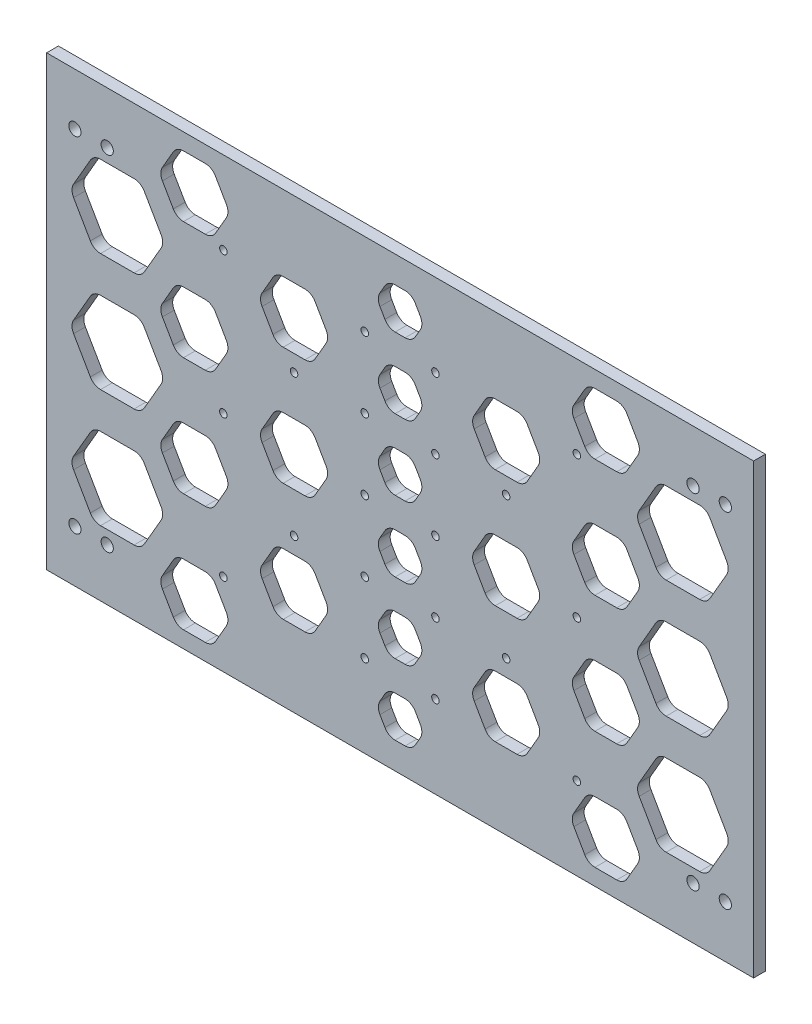
from build123d import *

# Parameters (mm, degrees)
EXTRUDE_2_DEPTH     = 5
SKETCH_2_W          = 5
SKETCH_2_H          = 30
CUT_EXTRUDE_1_DEPTH = 10
CUT_EXTRUDE_2_DEPTH = 10
EXTRUDE_3_REACH     = 316.046
SKETCH_4_W          = 5
SKETCH_4_H          = 50
SKETCH_5_R          = 1
SKETCH_5_W          = 5
SKETCH_5_H          = 30
CUT_EXTRUDE_3_DEPTH = 5
SKETCH_6_R          = 2.6
CUT_EXTRUDE_4_DEPTH = 356.140817142
SKETCH_7_R          = 1.6
CUT_EXTRUDE_5_DEPTH = 356.140817142
CUT_EXTRUDE_6_DEPTH = 10
CUT_EXTRUDE_7_DEPTH = 10
CUT_EXTRUDE_8_DEPTH = 10
EXTRUDE_4_DEPTH     = 5
CUT_EXTRUDE_9_DEPTH = 10
EXTRUDE_5_DEPTH     = 5
FILLET_2_R          = 5
FILLET_3_R          = 5


with BuildPart() as part:
    # 草图1 → 凸台-拉伸2 (new body)
    with BuildSketch(Plane.XY):
        Polygon((0, 0), (0, -95), (300, -95), (300, 0), (250, 0), (250, -50), (50, -50), (50, 0), align=None)
        Polygon((300, -95), (0, -95), (0, -190), (50, -190), (50, -140), (250, -140), (250, -190), (300, -190), align=None)
    extrude(amount=EXTRUDE_2_DEPTH)

    # 草图2 → 切除-拉伸1 (cut)
    with BuildSketch(Plane.XY.offset(5)):
        with Locations((2.5, -50)):
            Rectangle(SKETCH_2_W, SKETCH_2_H)
        with Locations((2.5, -140)):
            Rectangle(SKETCH_2_W, SKETCH_2_H)
        with Locations((297.5, -50)):
            Rectangle(SKETCH_2_W, SKETCH_2_H)
        with Locations((297.5, -140)):
            Rectangle(SKETCH_2_W, SKETCH_2_H)
    extrude(amount=-CUT_EXTRUDE_1_DEPTH, mode=Mode.SUBTRACT)

    # 草图3 → 切除-拉伸2 (cut)
    with BuildSketch(Plane.XY.offset(5)):
        with BuildLine():
            ThreePointArc((4, -35), (4.292893219, -35.707106781), (5, -36))
            Line((5, -36), (5, -35))
            Line((5, -35), (4, -35))
        make_face()
        with BuildLine():
            Line((5, -35), (5, -36))
            ThreePointArc((5, -36), (5.707106781, -35.707106781), (6, -35))
            ThreePointArc((6, -35), (5, -34), (4, -35))
            Line((4, -35), (5, -35))
        make_face()
        with BuildLine():
            ThreePointArc((4, -35), (4.292893219, -35.707106781), (5, -36))
            Line((5, -36), (5, -35))
            Line((5, -35), (4, -35))
        make_face()
        with BuildLine():
            Line((5, -35), (5, -36))
            ThreePointArc((5, -36), (5.707106781, -35.707106781), (6, -35))
            ThreePointArc((6, -35), (5, -34), (4, -35))
            Line((4, -35), (5, -35))
        make_face()
        with BuildLine():
            ThreePointArc((5, -64), (4.292893219, -64.292893219), (4, -65))
            Line((4, -65), (5, -65))
            Line((5, -65), (5, -64))
        make_face()
        with BuildLine():
            Line((5, -65), (4, -65))
            ThreePointArc((4, -65), (5, -66), (6, -65))
            ThreePointArc((6, -65), (5.707106781, -64.292893219), (5, -64))
            Line((5, -64), (5, -65))
        make_face()
        with BuildLine():
            ThreePointArc((6, -125), (5, -124), (4, -125))
            Line((4, -125), (5, -125))
            Line((5, -125), (5, -126))
            ThreePointArc((5, -126), (5.707106781, -125.707106781), (6, -125))
        make_face()
        with BuildLine():
            Line((5, -125), (4, -125))
            ThreePointArc((4, -125), (4.292893219, -125.707106781), (5, -126))
            Line((5, -126), (5, -125))
        make_face()
        with BuildLine():
            ThreePointArc((6, -155), (5.707106781, -154.292893219), (5, -154))
            Line((5, -154), (5, -155))
            Line((5, -155), (4, -155))
            ThreePointArc((4, -155), (5, -156), (6, -155))
        make_face()
        with BuildLine():
            Line((5, -155), (5, -154))
            ThreePointArc((5, -154), (4.292893219, -154.292893219), (4, -155))
            Line((4, -155), (5, -155))
        make_face()
        with BuildLine():
            ThreePointArc((296, -155), (295.707106781, -154.292893219), (295, -154))
            Line((295, -154), (295, -155))
            Line((295, -155), (296, -155))
        make_face()
        with BuildLine():
            Line((295, -155), (295, -154))
            ThreePointArc((295, -154), (294.292893219, -155.707106781), (296, -155))
            Line((296, -155), (295, -155))
        make_face()
        with BuildLine():
            ThreePointArc((295, -126), (295.707106781, -125.707106781), (296, -125))
            Line((296, -125), (295, -125))
            Line((295, -125), (295, -126))
        make_face()
        with BuildLine():
            Line((295, -125), (296, -125))
            ThreePointArc((296, -125), (294.292893219, -124.292893219), (295, -126))
            Line((295, -126), (295, -125))
        make_face()
        with BuildLine():
            ThreePointArc((296, -35), (294.292893219, -34.292893219), (295, -36))
            Line((295, -36), (295, -35))
            Line((295, -35), (296, -35))
        make_face()
        with BuildLine():
            Line((295, -35), (295, -36))
            ThreePointArc((295, -36), (295.707106781, -35.707106781), (296, -35))
            Line((296, -35), (295, -35))
        make_face()
        with BuildLine():
            ThreePointArc((295, -64), (294.292893219, -65.707106781), (296, -65))
            Line((296, -65), (295, -65))
            Line((295, -65), (295, -64))
        make_face()
        with BuildLine():
            Line((295, -65), (296, -65))
            ThreePointArc((296, -65), (295.707106781, -64.292893219), (295, -64))
            Line((295, -64), (295, -65))
        make_face()
    extrude(amount=-CUT_EXTRUDE_2_DEPTH, mode=Mode.SUBTRACT)

    # 草图4 → 凸台-拉伸3 (add, up to next)
    with BuildSketch(Plane(origin=(50, 0, 0), x_dir=(0, 0, -1), z_dir=(1, 0, 0)), mode=Mode.PRIVATE) as extrude_3_sk1:
        with Locations((-2.5, -25)):
            Rectangle(SKETCH_4_W, SKETCH_4_H)
    extrude_3_tool1 = extrude(extrude_3_sk1.sketch, amount=EXTRUDE_3_REACH, mode=Mode.PRIVATE) - part.part
    # 草图4 → 凸台-拉伸3 (add, up to next)
    with BuildSketch(Plane(origin=(50, 0, 0), x_dir=(0, 0, -1), z_dir=(1, 0, 0)), mode=Mode.PRIVATE) as extrude_3_sk2:
        with Locations((-2.5, -165)):
            Rectangle(SKETCH_4_W, SKETCH_4_H)
    extrude_3_tool2 = extrude(extrude_3_sk2.sketch, amount=EXTRUDE_3_REACH, mode=Mode.PRIVATE) - part.part
    add(extrude_3_tool1.solids().sort_by_distance((50, -25, 2.5))[0])
    add(extrude_3_tool2.solids().sort_by_distance((50, -165, 2.5))[0])

    # 草图5 → 切除-拉伸3 (cut)
    with BuildSketch(Plane.XY.offset(5)):
        with Locations((37.7, -65)):
            Circle(SKETCH_5_R)
        with Locations((37.7, -35)):
            Circle(SKETCH_5_R)
        with Locations((32.7, -35)):
            Circle(SKETCH_5_R)
        with Locations((32.7, -65)):
            Circle(SKETCH_5_R)
        with Locations((35.2, -50)):
            Rectangle(SKETCH_5_W, SKETCH_5_H)
        with BuildLine():
            Line((32.7, -36), (32.7, -35))
            Line((32.7, -35), (33.7, -35))
            ThreePointArc((33.7, -35), (31.992893219, -34.292893219), (32.7, -36))
        make_face()
        with BuildLine():
            Line((33.7, -35), (32.7, -35))
            Line((32.7, -35), (32.7, -36))
            ThreePointArc((32.7, -36), (33.407106781, -35.707106781), (33.7, -35))
        make_face()
        with BuildLine():
            ThreePointArc((38.7, -35), (37.7, -34), (36.7, -35))
            Line((36.7, -35), (37.7, -35))
            Line((37.7, -35), (37.7, -36))
            ThreePointArc((37.7, -36), (38.407106781, -35.707106781), (38.7, -35))
        make_face()
        with BuildLine():
            Line((37.7, -35), (36.7, -35))
            ThreePointArc((36.7, -35), (36.992893219, -35.707106781), (37.7, -36))
            Line((37.7, -36), (37.7, -35))
        make_face()
        with BuildLine():
            ThreePointArc((38.7, -35), (37.7, -34), (36.7, -35))
            Line((36.7, -35), (37.7, -35))
            Line((37.7, -35), (37.7, -36))
            ThreePointArc((37.7, -36), (38.407106781, -35.707106781), (38.7, -35))
        make_face()
        with BuildLine():
            Line((37.7, -35), (36.7, -35))
            ThreePointArc((36.7, -35), (36.992893219, -35.707106781), (37.7, -36))
            Line((37.7, -36), (37.7, -35))
        make_face()
        with BuildLine():
            Line((32.7, -36), (32.7, -35))
            Line((32.7, -35), (33.7, -35))
            ThreePointArc((33.7, -35), (31.992893219, -34.292893219), (32.7, -36))
        make_face()
        with BuildLine():
            Line((33.7, -35), (32.7, -35))
            Line((32.7, -35), (32.7, -36))
            ThreePointArc((32.7, -36), (33.407106781, -35.707106781), (33.7, -35))
        make_face()
        with BuildLine():
            ThreePointArc((33.7, -65), (33.407106781, -64.292893219), (32.7, -64))
            Line((32.7, -64), (32.7, -65))
            Line((32.7, -65), (33.7, -65))
        make_face()
        with BuildLine():
            Line((32.7, -65), (32.7, -64))
            ThreePointArc((32.7, -64), (31.992893219, -65.707106781), (33.7, -65))
            Line((33.7, -65), (32.7, -65))
        make_face()
        with BuildLine():
            ThreePointArc((33.7, -65), (33.407106781, -64.292893219), (32.7, -64))
            Line((32.7, -64), (32.7, -65))
            Line((32.7, -65), (33.7, -65))
        make_face()
        with BuildLine():
            Line((32.7, -65), (32.7, -64))
            ThreePointArc((32.7, -64), (31.992893219, -65.707106781), (33.7, -65))
            Line((33.7, -65), (32.7, -65))
        make_face()
        with BuildLine():
            ThreePointArc((38.7, -65), (38.407106781, -64.292893219), (37.7, -64))
            Line((37.7, -64), (37.7, -65))
            Line((37.7, -65), (36.7, -65))
            ThreePointArc((36.7, -65), (37.7, -66), (38.7, -65))
        make_face()
        with BuildLine():
            Line((37.7, -65), (37.7, -64))
            ThreePointArc((37.7, -64), (36.992893219, -64.292893219), (36.7, -65))
            Line((36.7, -65), (37.7, -65))
        make_face()
        with BuildLine():
            ThreePointArc((38.7, -65), (38.407106781, -64.292893219), (37.7, -64))
            Line((37.7, -64), (37.7, -65))
            Line((37.7, -65), (36.7, -65))
            ThreePointArc((36.7, -65), (37.7, -66), (38.7, -65))
        make_face()
        with BuildLine():
            Line((37.7, -65), (37.7, -64))
            ThreePointArc((37.7, -64), (36.992893219, -64.292893219), (36.7, -65))
            Line((36.7, -65), (37.7, -65))
        make_face()
        with BuildLine():
            ThreePointArc((33.7, -155), (33.407106781, -154.292893219), (32.7, -154))
            Line((32.7, -154), (32.7, -155))
            Line((32.7, -155), (33.7, -155))
        make_face()
        with BuildLine():
            Line((32.7, -155), (32.7, -154))
            ThreePointArc((32.7, -154), (31.992893219, -155.707106781), (33.7, -155))
            Line((33.7, -155), (32.7, -155))
        make_face()
        with BuildLine():
            ThreePointArc((33.7, -155), (33.407106781, -154.292893219), (32.7, -154))
            Line((32.7, -154), (32.7, -155))
            Line((32.7, -155), (33.7, -155))
        make_face()
        with BuildLine():
            Line((32.7, -155), (32.7, -154))
            ThreePointArc((32.7, -154), (31.992893219, -155.707106781), (33.7, -155))
            Line((33.7, -155), (32.7, -155))
        make_face()
        with Locations((32.7, -155)):
            Circle(SKETCH_5_R)
        with Locations((37.7, -155)):
            Circle(SKETCH_5_R)
        with Locations((37.7, -125)):
            Circle(SKETCH_5_R)
        with Locations((32.7, -125)):
            Circle(SKETCH_5_R)
        with Locations((35.2, -140)):
            Rectangle(SKETCH_5_W, SKETCH_5_H)
        with BuildLine():
            ThreePointArc((38.7, -155), (38.407106781, -154.292893219), (37.7, -154))
            Line((37.7, -154), (37.7, -155))
            Line((37.7, -155), (36.7, -155))
            ThreePointArc((36.7, -155), (37.7, -156), (38.7, -155))
        make_face()
        with BuildLine():
            Line((37.7, -155), (37.7, -154))
            ThreePointArc((37.7, -154), (36.992893219, -154.292893219), (36.7, -155))
            Line((36.7, -155), (37.7, -155))
        make_face()
        with BuildLine():
            ThreePointArc((38.7, -155), (38.407106781, -154.292893219), (37.7, -154))
            Line((37.7, -154), (37.7, -155))
            Line((37.7, -155), (36.7, -155))
            ThreePointArc((36.7, -155), (37.7, -156), (38.7, -155))
        make_face()
        with BuildLine():
            Line((37.7, -155), (37.7, -154))
            ThreePointArc((37.7, -154), (36.992893219, -154.292893219), (36.7, -155))
            Line((36.7, -155), (37.7, -155))
        make_face()
        with BuildLine():
            Line((32.7, -126), (32.7, -125))
            Line((32.7, -125), (33.7, -125))
            ThreePointArc((33.7, -125), (31.992893219, -124.292893219), (32.7, -126))
        make_face()
        with BuildLine():
            Line((33.7, -125), (32.7, -125))
            Line((32.7, -125), (32.7, -126))
            ThreePointArc((32.7, -126), (33.407106781, -125.707106781), (33.7, -125))
        make_face()
        with BuildLine():
            Line((32.7, -126), (32.7, -125))
            Line((32.7, -125), (33.7, -125))
            ThreePointArc((33.7, -125), (31.992893219, -124.292893219), (32.7, -126))
        make_face()
        with BuildLine():
            Line((33.7, -125), (32.7, -125))
            Line((32.7, -125), (32.7, -126))
            ThreePointArc((32.7, -126), (33.407106781, -125.707106781), (33.7, -125))
        make_face()
        with BuildLine():
            ThreePointArc((38.7, -125), (37.7, -124), (36.7, -125))
            Line((36.7, -125), (37.7, -125))
            Line((37.7, -125), (37.7, -126))
            ThreePointArc((37.7, -126), (38.407106781, -125.707106781), (38.7, -125))
        make_face()
        with BuildLine():
            Line((37.7, -125), (36.7, -125))
            ThreePointArc((36.7, -125), (36.992893219, -125.707106781), (37.7, -126))
            Line((37.7, -126), (37.7, -125))
        make_face()
        with BuildLine():
            ThreePointArc((38.7, -125), (37.7, -124), (36.7, -125))
            Line((36.7, -125), (37.7, -125))
            Line((37.7, -125), (37.7, -126))
            ThreePointArc((37.7, -126), (38.407106781, -125.707106781), (38.7, -125))
        make_face()
        with BuildLine():
            Line((37.7, -125), (36.7, -125))
            ThreePointArc((36.7, -125), (36.992893219, -125.707106781), (37.7, -126))
            Line((37.7, -126), (37.7, -125))
        make_face()
        with Locations((262.3, -65)):
            Circle(SKETCH_5_R)
        with Locations((267.3, -65)):
            Circle(SKETCH_5_R)
        with Locations((267.3, -35)):
            Circle(SKETCH_5_R)
        with Locations((262.3, -35)):
            Circle(SKETCH_5_R)
        with Locations((264.8, -50)):
            Rectangle(SKETCH_5_W, SKETCH_5_H)
        with BuildLine():
            ThreePointArc((263.3, -35), (261.592893219, -34.292893219), (262.3, -36))
            Line((262.3, -36), (262.3, -35))
            Line((262.3, -35), (263.3, -35))
        make_face()
        with BuildLine():
            Line((262.3, -35), (262.3, -36))
            ThreePointArc((262.3, -36), (263.007106781, -35.707106781), (263.3, -35))
            Line((263.3, -35), (262.3, -35))
        make_face()
        with BuildLine():
            ThreePointArc((263.3, -35), (261.592893219, -34.292893219), (262.3, -36))
            Line((262.3, -36), (262.3, -35))
            Line((262.3, -35), (263.3, -35))
        make_face()
        with BuildLine():
            Line((262.3, -35), (262.3, -36))
            ThreePointArc((262.3, -36), (263.007106781, -35.707106781), (263.3, -35))
            Line((263.3, -35), (262.3, -35))
        make_face()
        with BuildLine():
            ThreePointArc((266.3, -35), (266.592893219, -35.707106781), (267.3, -36))
            Line((267.3, -36), (267.3, -35))
            Line((267.3, -35), (266.3, -35))
        make_face()
        with BuildLine():
            Line((267.3, -35), (267.3, -36))
            ThreePointArc((267.3, -36), (268.007106781, -35.707106781), (268.3, -35))
            ThreePointArc((268.3, -35), (267.3, -34), (266.3, -35))
            Line((266.3, -35), (267.3, -35))
        make_face()
        with BuildLine():
            ThreePointArc((266.3, -35), (266.592893219, -35.707106781), (267.3, -36))
            Line((267.3, -36), (267.3, -35))
            Line((267.3, -35), (266.3, -35))
        make_face()
        with BuildLine():
            Line((267.3, -35), (267.3, -36))
            ThreePointArc((267.3, -36), (268.007106781, -35.707106781), (268.3, -35))
            ThreePointArc((268.3, -35), (267.3, -34), (266.3, -35))
            Line((266.3, -35), (267.3, -35))
        make_face()
        with BuildLine():
            ThreePointArc((262.3, -64), (261.592893219, -65.707106781), (263.3, -65))
            Line((263.3, -65), (262.3, -65))
            Line((262.3, -65), (262.3, -64))
        make_face()
        with BuildLine():
            Line((262.3, -65), (263.3, -65))
            ThreePointArc((263.3, -65), (263.007106781, -64.292893219), (262.3, -64))
            Line((262.3, -64), (262.3, -65))
        make_face()
        with BuildLine():
            ThreePointArc((262.3, -64), (261.592893219, -65.707106781), (263.3, -65))
            Line((263.3, -65), (262.3, -65))
            Line((262.3, -65), (262.3, -64))
        make_face()
        with BuildLine():
            Line((262.3, -65), (263.3, -65))
            ThreePointArc((263.3, -65), (263.007106781, -64.292893219), (262.3, -64))
            Line((262.3, -64), (262.3, -65))
        make_face()
        with BuildLine():
            ThreePointArc((267.3, -64), (266.592893219, -64.292893219), (266.3, -65))
            Line((266.3, -65), (267.3, -65))
            Line((267.3, -65), (267.3, -64))
        make_face()
        with BuildLine():
            Line((267.3, -65), (266.3, -65))
            ThreePointArc((266.3, -65), (267.3, -66), (268.3, -65))
            ThreePointArc((268.3, -65), (268.007106781, -64.292893219), (267.3, -64))
            Line((267.3, -64), (267.3, -65))
        make_face()
        with BuildLine():
            ThreePointArc((267.3, -64), (266.592893219, -64.292893219), (266.3, -65))
            Line((266.3, -65), (267.3, -65))
            Line((267.3, -65), (267.3, -64))
        make_face()
        with BuildLine():
            Line((267.3, -65), (266.3, -65))
            ThreePointArc((266.3, -65), (267.3, -66), (268.3, -65))
            ThreePointArc((268.3, -65), (268.007106781, -64.292893219), (267.3, -64))
            Line((267.3, -64), (267.3, -65))
        make_face()
        with BuildLine():
            ThreePointArc((262.3, -126), (263.007106781, -125.707106781), (263.3, -125))
            Line((263.3, -125), (262.3, -125))
            Line((262.3, -125), (262.3, -126))
        make_face()
        with BuildLine():
            Line((262.3, -125), (263.3, -125))
            ThreePointArc((263.3, -125), (261.592893219, -124.292893219), (262.3, -126))
            Line((262.3, -126), (262.3, -125))
        make_face()
        with BuildLine():
            ThreePointArc((262.3, -126), (263.007106781, -125.707106781), (263.3, -125))
            Line((263.3, -125), (262.3, -125))
            Line((262.3, -125), (262.3, -126))
        make_face()
        with BuildLine():
            Line((262.3, -125), (263.3, -125))
            ThreePointArc((263.3, -125), (261.592893219, -124.292893219), (262.3, -126))
            Line((262.3, -126), (262.3, -125))
        make_face()
        with Locations((267.3, -125)):
            Circle(SKETCH_5_R)
        with Locations((262.3, -125)):
            Circle(SKETCH_5_R)
        with Locations((262.3, -155)):
            Circle(SKETCH_5_R)
        with Locations((267.3, -155)):
            Circle(SKETCH_5_R)
        with Locations((264.8, -140)):
            Rectangle(SKETCH_5_W, SKETCH_5_H)
        with BuildLine():
            ThreePointArc((266.3, -125), (266.592893219, -125.707106781), (267.3, -126))
            Line((267.3, -126), (267.3, -125))
            Line((267.3, -125), (266.3, -125))
        make_face()
        with BuildLine():
            Line((267.3, -125), (267.3, -126))
            ThreePointArc((267.3, -126), (268.007106781, -125.707106781), (268.3, -125))
            ThreePointArc((268.3, -125), (267.3, -124), (266.3, -125))
            Line((266.3, -125), (267.3, -125))
        make_face()
        with BuildLine():
            ThreePointArc((266.3, -125), (266.592893219, -125.707106781), (267.3, -126))
            Line((267.3, -126), (267.3, -125))
            Line((267.3, -125), (266.3, -125))
        make_face()
        with BuildLine():
            Line((267.3, -125), (267.3, -126))
            ThreePointArc((267.3, -126), (268.007106781, -125.707106781), (268.3, -125))
            ThreePointArc((268.3, -125), (267.3, -124), (266.3, -125))
            Line((266.3, -125), (267.3, -125))
        make_face()
        with BuildLine():
            ThreePointArc((262.3, -154), (261.592893219, -155.707106781), (263.3, -155))
            Line((263.3, -155), (262.3, -155))
            Line((262.3, -155), (262.3, -154))
        make_face()
        with BuildLine():
            Line((262.3, -155), (263.3, -155))
            ThreePointArc((263.3, -155), (263.007106781, -154.292893219), (262.3, -154))
            Line((262.3, -154), (262.3, -155))
        make_face()
        with BuildLine():
            ThreePointArc((262.3, -154), (261.592893219, -155.707106781), (263.3, -155))
            Line((263.3, -155), (262.3, -155))
            Line((262.3, -155), (262.3, -154))
        make_face()
        with BuildLine():
            Line((262.3, -155), (263.3, -155))
            ThreePointArc((263.3, -155), (263.007106781, -154.292893219), (262.3, -154))
            Line((262.3, -154), (262.3, -155))
        make_face()
        with BuildLine():
            Line((266.3, -155), (267.3, -155))
            Line((267.3, -155), (267.3, -154))
            ThreePointArc((267.3, -154), (266.592893219, -154.292893219), (266.3, -155))
        make_face()
        with BuildLine():
            Line((267.3, -154), (267.3, -155))
            Line((267.3, -155), (266.3, -155))
            ThreePointArc((266.3, -155), (267.3, -156), (268.3, -155))
            ThreePointArc((268.3, -155), (268.007106781, -154.292893219), (267.3, -154))
        make_face()
        with BuildLine():
            Line((266.3, -155), (267.3, -155))
            Line((267.3, -155), (267.3, -154))
            ThreePointArc((267.3, -154), (266.592893219, -154.292893219), (266.3, -155))
        make_face()
        with BuildLine():
            Line((267.3, -154), (267.3, -155))
            Line((267.3, -155), (266.3, -155))
            ThreePointArc((266.3, -155), (267.3, -156), (268.3, -155))
            ThreePointArc((268.3, -155), (268.007106781, -154.292893219), (267.3, -154))
        make_face()
    extrude(amount=-CUT_EXTRUDE_3_DEPTH, mode=Mode.SUBTRACT)

    # 草图6 → 切除-拉伸4 (cut, through all)
    with BuildSketch(Plane.XY.offset(5)):
        with Locations((12, -22)):
            Circle(SKETCH_6_R)
        with Locations((25.7, -22)):
            Circle(SKETCH_6_R)
        with Locations((12, -168)):
            Circle(SKETCH_6_R)
        with Locations((25.7, -168)):
            Circle(SKETCH_6_R)
        with Locations((274.3, -168)):
            Circle(SKETCH_6_R)
        with Locations((288, -168)):
            Circle(SKETCH_6_R)
        with Locations((274.3, -22)):
            Circle(SKETCH_6_R)
        with Locations((288, -22)):
            Circle(SKETCH_6_R)
    extrude(amount=-CUT_EXTRUDE_4_DEPTH, mode=Mode.SUBTRACT)

    # 草图7 → 切除-拉伸5 (cut, through all)
    with BuildSketch(Plane.XY.offset(5)):
        with Locations((75, -35)):
            Circle(SKETCH_7_R)
        with Locations((105, -35)):
            Circle(SKETCH_7_R)
        with Locations((135, -35)):
            Circle(SKETCH_7_R)
        with Locations((165, -35)):
            Circle(SKETCH_7_R)
        with Locations((195, -35)):
            Circle(SKETCH_7_R)
        with Locations((225, -35)):
            Circle(SKETCH_7_R)
        with Locations((105, -65)):
            Circle(SKETCH_7_R)
        with Locations((135, -65)):
            Circle(SKETCH_7_R)
        with Locations((165, -65)):
            Circle(SKETCH_7_R)
        with Locations((195, -65)):
            Circle(SKETCH_7_R)
        with Locations((225, -65)):
            Circle(SKETCH_7_R)
        with Locations((105, -95)):
            Circle(SKETCH_7_R)
        with Locations((135, -95)):
            Circle(SKETCH_7_R)
        with Locations((165, -95)):
            Circle(SKETCH_7_R)
        with Locations((195, -95)):
            Circle(SKETCH_7_R)
        with Locations((225, -95)):
            Circle(SKETCH_7_R)
        with Locations((105, -125)):
            Circle(SKETCH_7_R)
        with Locations((135, -125)):
            Circle(SKETCH_7_R)
        with Locations((165, -125)):
            Circle(SKETCH_7_R)
        with Locations((195, -125)):
            Circle(SKETCH_7_R)
        with Locations((225, -125)):
            Circle(SKETCH_7_R)
        with Locations((105, -155)):
            Circle(SKETCH_7_R)
        with Locations((135, -155)):
            Circle(SKETCH_7_R)
        with Locations((165, -155)):
            Circle(SKETCH_7_R)
        with Locations((195, -155)):
            Circle(SKETCH_7_R)
        with Locations((225, -155)):
            Circle(SKETCH_7_R)
        with Locations((75, -65)):
            Circle(SKETCH_7_R)
        with Locations((75, -95)):
            Circle(SKETCH_7_R)
        with Locations((75, -125)):
            Circle(SKETCH_7_R)
        with Locations((75, -155)):
            Circle(SKETCH_7_R)
    extrude(amount=-CUT_EXTRUDE_5_DEPTH, mode=Mode.SUBTRACT)

    # 草图9 → 切除-拉伸6 (cut)
    with BuildSketch(Plane.XY.offset(5)):
        Polygon((55.2, -32.990762114), (70.2, -32.990762114), (77.7, -20.000381057), (70.2, -7.01), (55.2, -7.01), (47.7, -20.000381057), align=None)
        Polygon((97.5, -57.990381057), (112.5, -57.990381057), (120, -45), (112.5, -32.009618943), (97.5, -32.009618943), (90, -45), align=None)
        Polygon((55.2, -82.990762114), (70.2, -82.990762114), (77.7, -70.000381057), (70.2, -57.01), (55.2, -57.01), (47.7, -70.000381057), align=None)
        Polygon((90, -95), (120, -95), (112.5, -82.009618943), (97.5, -82.009618943), align=None)
        Polygon((55.2, -132.990762114), (70.2, -132.990762114), (77.7, -120.000381057), (70.2, -107.01), (55.2, -107.01), (47.7, -120.000381057), align=None)
        Polygon((112.5, -107.990381057), (120, -95), (90, -95), (97.5, -107.990381057), align=None)
        Polygon((120, -145), (112.5, -157.990381057), (97.5, -157.990381057), (90, -145), (97.5, -132.009618943), (112.5, -132.009618943), align=None)
        Polygon((55.2, -182.990762114), (70.2, -182.990762114), (77.7, -170.000381057), (70.2, -157.01), (55.2, -157.01), (47.7, -170.000381057), align=None)
        Polygon((180, -145), (187.5, -157.990381057), (202.5, -157.990381057), (210, -145), (202.5, -132.009618943), (187.5, -132.009618943), align=None)
        Polygon((222.3, -170.000381057), (229.8, -157.01), (244.8, -157.01), (252.3, -170.000381057), (244.8, -182.990762114), (229.8, -182.990762114), align=None)
        Polygon((222.3, -120.000381057), (229.8, -107.01), (244.8, -107.01), (252.3, -120.000381057), (244.8, -132.990762114), (229.8, -132.990762114), align=None)
        Polygon((187.5, -82.009618943), (180, -95), (210, -95), (202.5, -82.009618943), align=None)
        Polygon((222.3, -70.000381057), (229.8, -57.01), (244.8, -57.01), (252.3, -70.000381057), (244.8, -82.990762114), (229.8, -82.990762114), align=None)
        Polygon((210, -95), (180, -95), (187.5, -107.990381057), (202.5, -107.990381057), align=None)
        Polygon((180, -45), (187.5, -32.009618943), (202.5, -32.009618943), (210, -45), (202.5, -57.990381057), (187.5, -57.990381057), align=None)
        Polygon((222.3, -20.000381057), (229.8, -7.01), (244.8, -7.01), (252.3, -20.000381057), (244.8, -32.990762114), (229.8, -32.990762114), align=None)
    extrude(amount=-CUT_EXTRUDE_6_DEPTH, mode=Mode.SUBTRACT)

    # 草图10 → 切除-拉伸7 (cut)
    with BuildSketch(Plane(origin=(0, 0, 0), x_dir=(-1, 0, 0), z_dir=(0, 0, -1))):
        Polygon((-145, -101.339745962), (-150, -101.339745962), (-150, -118.660254038), (-145, -118.660254038), (-140, -110), align=None)
        Polygon((-150, -118.660254038), (-150, -101.339745962), (-155, -101.339745962), (-160, -110), (-155, -118.660254038), align=None)
        Polygon((-145, -11.339745962), (-150, -11.339745962), (-150, -28.660254038), (-145, -28.660254038), (-140, -20), align=None)
        Polygon((-150, -28.660254038), (-150, -11.339745962), (-155, -11.339745962), (-160, -20), (-155, -28.660254038), align=None)
        Polygon((-155, -58.660254038), (-150, -50), (-156.339745962, -43.660254038), (-160, -50), align=None)
        Polygon((-145, -41.339745962), (-150, -50), (-143.660254038, -56.339745962), (-140, -50), align=None)
        Polygon((-145, -41.339745962), (-150, -41.339745962), (-150, -50), align=None)
        Polygon((-150, -50), (-150, -41.339745962), (-155, -41.339745962), (-156.339745962, -43.660254038), align=None)
        Polygon((-150, -58.660254038), (-150, -50), (-155, -58.660254038), align=None)
        Polygon((-143.660254038, -56.339745962), (-150, -50), (-150, -58.660254038), (-145, -58.660254038), align=None)
        Polygon((-150, -88.660254038), (-150, -71.339745962), (-155, -71.339745962), (-160, -80), (-155, -88.660254038), align=None)
        Polygon((-145, -71.339745962), (-150, -71.339745962), (-150, -88.660254038), (-145, -88.660254038), (-140, -80), align=None)
        Polygon((-145, -131.339745962), (-150, -131.339745962), (-150, -148.660254038), (-145, -148.660254038), (-140, -140), align=None)
        Polygon((-150, -148.660254038), (-150, -131.339745962), (-155, -131.339745962), (-160, -140), (-155, -148.660254038), align=None)
        Polygon((-145, -161.339745962), (-150, -161.339745962), (-150, -178.660254038), (-145, -178.660254038), (-140, -170), align=None)
        Polygon((-150, -178.660254038), (-150, -161.339745962), (-155, -161.339745962), (-160, -170), (-155, -178.660254038), align=None)
    extrude(amount=-CUT_EXTRUDE_7_DEPTH, mode=Mode.SUBTRACT)

    # 草图11 → 切除-拉伸8 (cut)
    with BuildSketch(Plane(origin=(0, 0, 0), x_dir=(-1, 0, 0), z_dir=(0, 0, -1))):
        Polygon((-40, -77.679491924), (-50, -95), (-10, -95), (-20, -77.679491924), align=None)
        Polygon((-10, -95), (-50, -95), (-40, -112.320508076), (-20, -112.320508076), align=None)
        Polygon((-280, -77.679491924), (-290, -95), (-250, -95), (-260, -77.679491924), align=None)
        Polygon((-250, -95), (-290, -95), (-280, -112.320508076), (-260, -112.320508076), align=None)
    extrude(amount=-CUT_EXTRUDE_8_DEPTH, mode=Mode.SUBTRACT)

    # 草图12 → 凸台-拉伸4 (add, through all)
    with BuildSketch(Plane.XY.offset(5)):
        with BuildLine():
            Line((33.7, -65), (36.7, -65))
            ThreePointArc((36.7, -65), (38.407106781, -65.707106781), (37.7, -64))
            Line((37.7, -64), (37.7, -36))
            ThreePointArc((37.7, -36), (38.407106781, -34.292893219), (36.7, -35))
            Line((36.7, -35), (33.7, -35))
            ThreePointArc((33.7, -35), (31.992893219, -34.292893219), (32.7, -36))
            Line((32.7, -36), (32.7, -64))
            ThreePointArc((32.7, -64), (31.992893219, -65.707106781), (33.7, -65))
        make_face()
        with BuildLine():
            Line((32.7, -126), (32.7, -154))
            ThreePointArc((32.7, -154), (31.992893219, -155.707106781), (33.7, -155))
            Line((33.7, -155), (36.7, -155))
            ThreePointArc((36.7, -155), (38.407106781, -155.707106781), (37.7, -154))
            Line((37.7, -154), (37.7, -126))
            ThreePointArc((37.7, -126), (38.407106781, -124.292893219), (36.7, -125))
            Line((36.7, -125), (33.7, -125))
            ThreePointArc((33.7, -125), (31.992893219, -124.292893219), (32.7, -126))
        make_face()
        with BuildLine():
            Line((75.656013634, -123.540669293), (74.064189352, -126.297789826))
            ThreePointArc((74.064189352, -126.297789826), (76.385640646, -125.8), (75.656013634, -123.540669293))
        make_face()
        with BuildLine():
            Line((74.063878705, -63.702434232), (75.655664271, -66.459487706))
            ThreePointArc((75.655664271, -66.459487706), (76.385640646, -64.2), (74.063878705, -63.702434232))
        make_face()
        with BuildLine():
            Line((225.936121295, -63.702434232), (224.344335729, -66.459487706))
            ThreePointArc((224.344335729, -66.459487706), (223.614359354, -64.2), (225.936121295, -63.702434232))
        make_face()
        with BuildLine():
            Line((267.3, -64), (267.3, -36))
            ThreePointArc((267.3, -36), (268.007106781, -34.292893219), (266.3, -35))
            Line((266.3, -35), (263.3, -35))
            ThreePointArc((263.3, -35), (261.592893219, -34.292893219), (262.3, -36))
            Line((262.3, -36), (262.3, -64))
            ThreePointArc((262.3, -64), (261.592893219, -65.707106781), (263.3, -65))
            Line((263.3, -65), (266.3, -65))
            ThreePointArc((266.3, -65), (268.007106781, -65.707106781), (267.3, -64))
        make_face()
        with BuildLine():
            Line((266.3, -125), (263.3, -125))
            ThreePointArc((263.3, -125), (261.592893219, -124.292893219), (262.3, -126))
            Line((262.3, -126), (262.3, -154))
            ThreePointArc((262.3, -154), (261.592893219, -155.707106781), (263.3, -155))
            Line((263.3, -155), (266.3, -155))
            ThreePointArc((266.3, -155), (268.007106781, -155.707106781), (267.3, -154))
            Line((267.3, -154), (267.3, -126))
            ThreePointArc((267.3, -126), (268.007106781, -124.292893219), (266.3, -125))
        make_face()
        with BuildLine():
            Line((224.343986366, -123.540669293), (225.935810648, -126.297789826))
            ThreePointArc((225.935810648, -126.297789826), (223.614359354, -125.8), (224.343986366, -123.540669293))
        make_face()
    extrude(amount=-EXTRUDE_4_DEPTH)

    # 草图13 → 切除-拉伸9 (cut)
    with BuildSketch(Plane.XY.offset(5)):
        Polygon((250, -45), (260, -62.320508076), (280, -62.320508076), (290, -45), (280, -27.679491924), (260, -27.679491924), align=None)
        Polygon((280, -127.679491924), (290, -145), (280, -162.320508076), (260, -162.320508076), (250, -145), (260, -127.679491924), align=None)
        Polygon((20, -62.320508076), (10, -45), (20, -27.679491924), (40, -27.679491924), (50, -45), (40, -62.320508076), align=None)
        Polygon((50, -145), (40, -127.679491924), (20, -127.679491924), (10, -145), (20, -162.320508076), (40, -162.320508076), align=None)
    extrude(amount=-CUT_EXTRUDE_9_DEPTH, mode=Mode.SUBTRACT)

    # 草图14 → 凸台-拉伸5 (add, through all)
    with BuildSketch(Plane.XY.offset(5)):
        with BuildLine():
            Line((4, -35), (0, -35))
            Line((0, -35), (0, -65))
            Line((0, -65), (4, -65))
            ThreePointArc((4, -65), (5.707106781, -65.707106781), (5, -64))
            Line((5, -64), (5, -36))
            ThreePointArc((5, -36), (5.707106781, -34.292893219), (4, -35))
        make_face()
        with BuildLine():
            Line((4, -125), (0, -125))
            Line((0, -125), (0, -155))
            Line((0, -155), (4, -155))
            ThreePointArc((4, -155), (5.707106781, -155.707106781), (5, -154))
            Line((5, -154), (5, -126))
            ThreePointArc((5, -126), (5.707106781, -124.292893219), (4, -125))
        make_face()
        with BuildLine():
            Line((300, -65), (300, -35))
            Line((300, -35), (296, -35))
            ThreePointArc((296, -35), (294.292893219, -34.292893219), (295, -36))
            Line((295, -36), (295, -64))
            ThreePointArc((295, -64), (294.292893219, -65.707106781), (296, -65))
            Line((296, -65), (300, -65))
        make_face()
        with BuildLine():
            Line((300, -155), (300, -125))
            Line((300, -125), (296, -125))
            ThreePointArc((296, -125), (294.292893219, -124.292893219), (295, -126))
            Line((295, -126), (295, -154))
            ThreePointArc((295, -154), (294.292893219, -155.707106781), (296, -155))
            Line((296, -155), (300, -155))
        make_face()
    extrude(amount=-EXTRUDE_5_DEPTH)

    # 圆角2
    fillet_2_edges = [part.edges().sort_by_distance(p)[0] for p in [
        (40, -77.679491924, 2.5),
        (20, -77.679491924, 2.5),
        (10, -95, 2.5),
        (20, -112.320508076, 2.5),
        (40, -112.320508076, 2.5),
        (50, -95, 2.5),
        (20, -62.320508076, 2.5),
        (10, -45, 2.5),
        (20, -27.679491924, 2.5),
        (40, -27.679491924, 2.5),
        (50, -45, 2.5),
        (40, -62.320508076, 2.5),
        (40, -127.679491924, 2.5),
        (50, -145, 2.5),
        (40, -162.320508076, 2.5),
        (20, -162.320508076, 2.5),
        (10, -145, 2.5),
        (20, -127.679491924, 2.5),
        (70.2, -182.990762114, 2.5),
        (55.2, -182.990762114, 2.5),
        (47.7, -170.000381057, 2.5),
        (55.2, -157.01, 2.5),
        (70.2, -157.01, 2.5),
        (77.7, -170.000381057, 2.5),
        (120, -145, 2.5),
        (112.5, -157.990381057, 2.5),
        (97.5, -157.990381057, 2.5),
        (90, -145, 2.5),
        (97.5, -132.009618943, 2.5),
        (112.5, -132.009618943, 2.5),
        (112.5, -57.990381057, 2.5),
        (97.5, -57.990381057, 2.5),
        (90, -45, 2.5),
        (97.5, -32.009618943, 2.5),
        (112.5, -32.009618943, 2.5),
        (120, -45, 2.5),
        (70.2, -82.990762114, 2.5),
        (55.2, -82.990762114, 2.5),
        (47.7, -70.000381057, 2.5),
        (55.2, -57.01, 2.5),
        (77.7, -70.000381057, 2.5),
        (70.2, -57.01, 2.5),
        (70.2, -132.990762114, 2.5),
        (55.2, -132.990762114, 2.5),
        (47.7, -120.000381057, 2.5),
        (55.2, -107.01, 2.5),
        (70.2, -107.01, 2.5),
        (77.7, -120.000381057, 2.5),
        (90, -95, 2.5),
        (97.5, -82.009618943, 2.5),
        (112.5, -82.009618943, 2.5),
        (120, -95, 2.5),
        (112.5, -107.990381057, 2.5),
        (97.5, -107.990381057, 2.5),
        (70.2, -32.990762114, 2.5),
        (55.2, -32.990762114, 2.5),
        (47.7, -20.000381057, 2.5),
        (55.2, -7.01, 2.5),
        (70.2, -7.01, 2.5),
        (77.7, -20.000381057, 2.5),
    ]]
    fillet(fillet_2_edges, radius=FILLET_2_R)

    # 圆角3
    fillet_3_edges = [part.edges().sort_by_distance(p)[0] for p in [
        (145, -161.339745962, 2.5),
        (140, -170, 2.5),
        (145, -178.660254038, 2.5),
        (155, -178.660254038, 2.5),
        (160, -170, 2.5),
        (155, -161.339745962, 2.5),
        (145, -131.339745962, 2.5),
        (140, -140, 2.5),
        (145, -148.660254038, 2.5),
        (155, -148.660254038, 2.5),
        (160, -140, 2.5),
        (155, -131.339745962, 2.5),
        (155, -71.339745962, 2.5),
        (145, -71.339745962, 2.5),
        (140, -80, 2.5),
        (145, -88.660254038, 2.5),
        (155, -88.660254038, 2.5),
        (160, -80, 2.5),
        (140, -50, 2.5),
        (145, -58.660254038, 2.5),
        (155, -58.660254038, 2.5),
        (160, -50, 2.5),
        (155, -41.339745962, 2.5),
        (145, -41.339745962, 2.5),
        (145, -11.339745962, 2.5),
        (140, -20, 2.5),
        (145, -28.660254038, 2.5),
        (155, -28.660254038, 2.5),
        (160, -20, 2.5),
        (155, -11.339745962, 2.5),
        (145, -101.339745962, 2.5),
        (140, -110, 2.5),
        (145, -118.660254038, 2.5),
        (155, -118.660254038, 2.5),
        (160, -110, 2.5),
        (155, -101.339745962, 2.5),
        (290, -95, 2.5),
        (280, -77.679491924, 2.5),
        (260, -77.679491924, 2.5),
        (250, -95, 2.5),
        (260, -112.320508076, 2.5),
        (280, -112.320508076, 2.5),
        (280, -127.679491924, 2.5),
        (290, -145, 2.5),
        (280, -162.320508076, 2.5),
        (260, -162.320508076, 2.5),
        (250, -145, 2.5),
        (260, -127.679491924, 2.5),
        (260, -62.320508076, 2.5),
        (250, -45, 2.5),
        (260, -27.679491924, 2.5),
        (280, -27.679491924, 2.5),
        (290, -45, 2.5),
        (280, -62.320508076, 2.5),
        (222.3, -170.000381057, 2.5),
        (229.8, -157.01, 2.5),
        (244.8, -157.01, 2.5),
        (252.3, -170.000381057, 2.5),
        (244.8, -182.990762114, 2.5),
        (229.8, -182.990762114, 2.5),
        (187.5, -157.990381057, 2.5),
        (180, -145, 2.5),
        (187.5, -132.009618943, 2.5),
        (202.5, -132.009618943, 2.5),
        (210, -145, 2.5),
        (202.5, -157.990381057, 2.5),
        (222.3, -20.000381057, 2.5),
        (229.8, -7.01, 2.5),
        (244.8, -7.01, 2.5),
        (252.3, -20.000381057, 2.5),
        (244.8, -32.990762114, 2.5),
        (229.8, -32.990762114, 2.5),
        (180, -45, 2.5),
        (187.5, -32.009618943, 2.5),
        (202.5, -32.009618943, 2.5),
        (210, -45, 2.5),
        (202.5, -57.990381057, 2.5),
        (187.5, -57.990381057, 2.5),
        (187.5, -82.009618943, 2.5),
        (202.5, -82.009618943, 2.5),
        (210, -95, 2.5),
        (202.5, -107.990381057, 2.5),
        (187.5, -107.990381057, 2.5),
        (180, -95, 2.5),
        (229.8, -57.01, 2.5),
        (244.8, -57.01, 2.5),
        (252.3, -70.000381057, 2.5),
        (244.8, -82.990762114, 2.5),
        (229.8, -82.990762114, 2.5),
        (222.3, -70.000381057, 2.5),
        (222.3, -120.000381057, 2.5),
        (229.8, -107.01, 2.5),
        (244.8, -107.01, 2.5),
        (252.3, -120.000381057, 2.5),
        (244.8, -132.990762114, 2.5),
        (229.8, -132.990762114, 2.5),
    ]]
    fillet(fillet_3_edges, radius=FILLET_3_R)


solid = part.part
